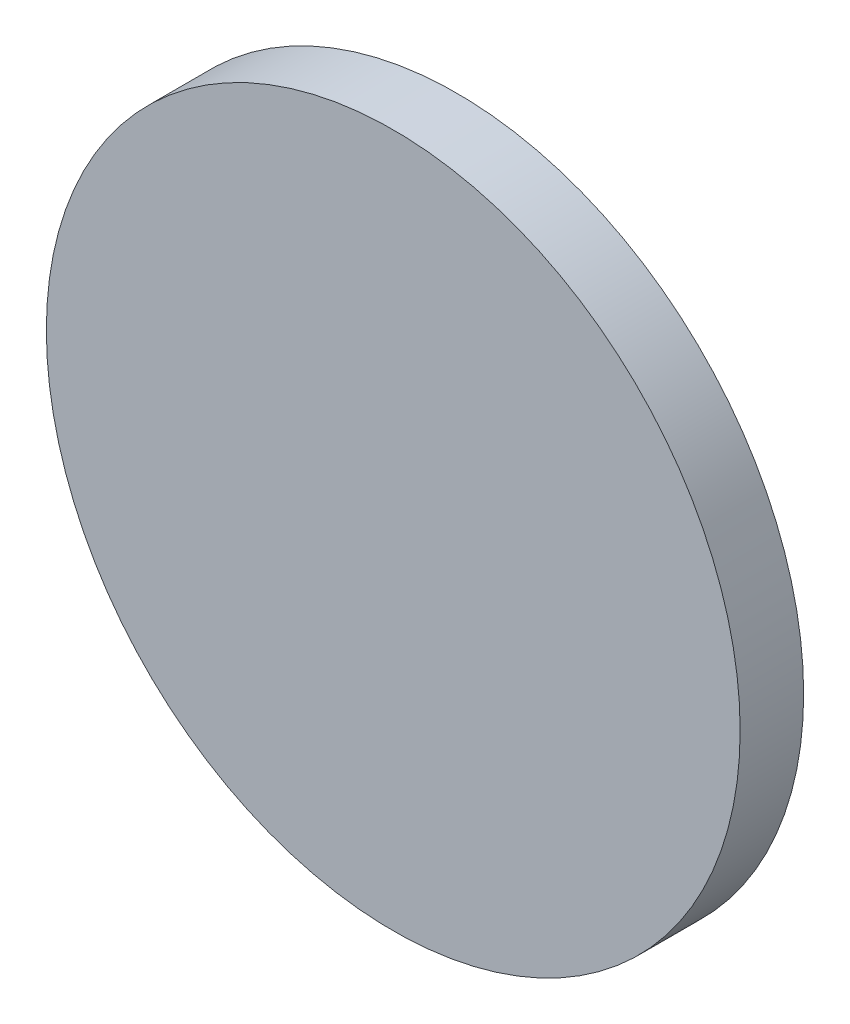
from build123d import *

# Parameters (mm, degrees)
SKETCH1_R           = 34.694413408
BOSS_EXTRUDE1_DEPTH = 6.35


with BuildPart() as part:
    # Sketch1 → Boss-Extrude1 (new body)
    with BuildSketch(Plane.XY):
        Circle(SKETCH1_R)
    extrude(amount=BOSS_EXTRUDE1_DEPTH)


solid = part.part
